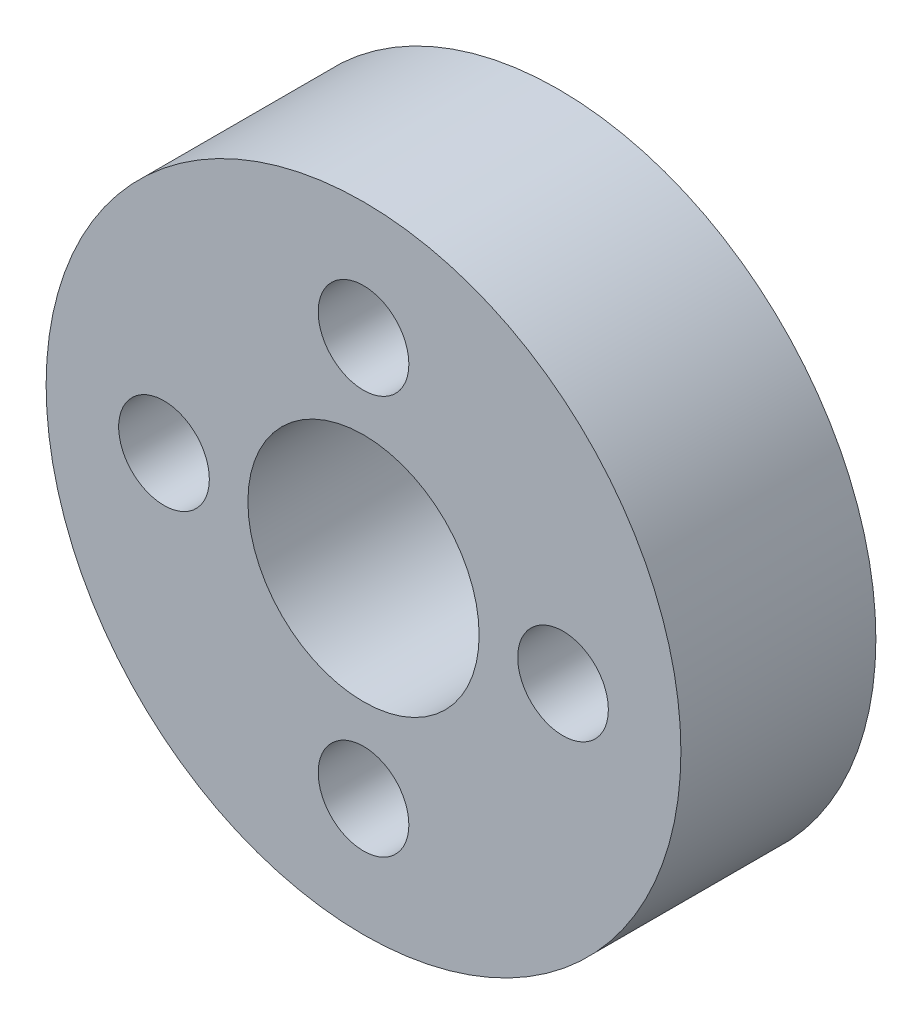
from build123d import *
from build123d.topology import SkipClean

# Parameters (mm, degrees)
SKETCH1_R           = 17.78
SKETCH1_R_2         = 2.54
SKETCH1_R_3         = 6.477
BOSS_EXTRUDE1_DEPTH = 10.922
BOSS_EXTRUDE2_START = 3.175
SKETCH2_W           = 16.51
SKETCH2_H           = 16.51
SKETCH2_R           = 6.477
BOSS_EXTRUDE2_DEPTH = 3.175


with BuildPart() as part:
    # Sketch1 → Boss-Extrude1 (new body)
    with BuildSketch(Plane.XY):
        Circle(SKETCH1_R)
        with Locations((-11.176, 0)):
            Circle(SKETCH1_R_2, mode=Mode.SUBTRACT)
        with Locations((0, -11.176)):
            Circle(SKETCH1_R_2, mode=Mode.SUBTRACT)
        with Locations((11.176, 0)):
            Circle(SKETCH1_R_2, mode=Mode.SUBTRACT)
        with Locations((0, 11.176)):
            Circle(SKETCH1_R_2, mode=Mode.SUBTRACT)
        Circle(SKETCH1_R_3, mode=Mode.SUBTRACT)
    extrude(amount=BOSS_EXTRUDE1_DEPTH)

    # Sketch2 → Boss-Extrude2 (add)
    with SkipClean():  # the faces are left unmerged after this step: merging them gives an invalid solid
        with BuildSketch(Plane(origin=(0, 0, 0), x_dir=(-1, 0, 0), z_dir=(0, 0, -1)).offset(BOSS_EXTRUDE2_START)):
            Rectangle(SKETCH2_W, SKETCH2_H)
            Circle(SKETCH2_R, mode=Mode.SUBTRACT)
        extrude(amount=-BOSS_EXTRUDE2_DEPTH)


solid = part.part
